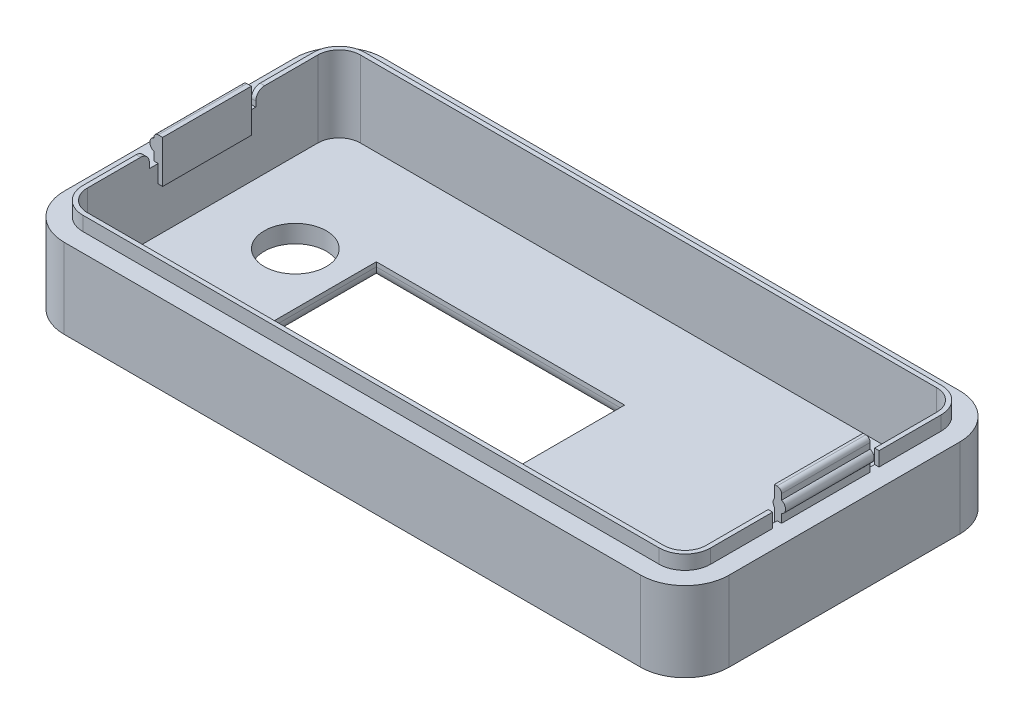
from build123d import *

# Parameters (mm, degrees)
EXTRUDE_2_DEPTH       = 9
EXTRUDE_4_DEPTH       = 1.6
SKETCH_7_W            = 0.5
SKETCH_7_H            = 10
EXTRUDE_8_DEPTH       = 2.8
SKETCH_8_R            = 0.7
EXTRUDE_9_DEPTH       = 10
FILLET_1_R            = 0.5
SKETCH_11_W           = 1
SKETCH_11_H           = 1.6
CUT_EXTRUDE_1_DEPTH   = 1.2
FILLET_2_R            = 1
SKETCH_13_W           = 0.5
SKETCH_13_H           = 10
EXTRUDE_10_DEPTH      = 2.8
CUT_EXTRUDE_START     = -7
CUT_EXTRUDE_2_DEPTH   = 7
SKETCH_13_2_W         = 0.5
SKETCH_13_2_H         = 10
EXTRUDE_11_DEPTH      = 2
EXTRUDE_12_DEPTH      = 1.6
EXTRUDE_12_DEPTH_BACK = 2
SKETCH_5_W            = 0.3
SKETCH_5_H            = 10
SKETCH_17_W           = 0.5
SKETCH_17_H           = 1
CUT_EXTRUDE_3_DEPTH   = 1.6
SKETCH_19_W           = 0.8
SKETCH_19_H           = 10
EXTRUDE_15_DEPTH      = 1.8
SKETCH_20_R           = 0.7
EXTRUDE_16_DEPTH      = 10
FILLET_4_R            = 0.5
CUT_EXTRUDE_12_REACH  = 46.232
SKETCH_27_W           = 28
SKETCH_27_H           = 15.7
FILLET_17_R           = 1.5
CUT_EXTRUDE_13_REACH  = 46.744
SKETCH_37_R           = 3.5
CUT_EXTRUDE_START_2   = -0.5
CUT_EXTRUDE_14_DEPTH  = 0.5
CUT_EXTRUDE_15_REACH  = 46.744
SKETCH_38_W           = 2.5
SKETCH_38_H           = 10
FILLET_18_R           = 1
CUT_EXTRUDE_START_3   = -0.8
CUT_EXTRUDE_16_DEPTH  = 0.8


# Read off the part's stored shape, not the designer's step: 切除-拉伸14, 切除-拉伸16
with BuildPart() as part:
    # case 2 → 凸台-拉伸2 (new body)
    with BuildSketch(Plane(origin=(0, 0, 0), x_dir=(1, 0, 0), z_dir=(0, 1, 0))):
        with BuildLine():
            Line((-34.042196447, 18), (30.957803553, 18))
            ThreePointArc((30.957803553, 18), (34.493337459, 16.535533906), (35.957803553, 13))
            Line((35.957803553, 13), (35.957803553, -13))
            ThreePointArc((35.957803553, -13), (34.493337459, -16.535533906), (30.957803553, -18))
            Line((30.957803553, -18), (-34.042196447, -18))
            ThreePointArc((-34.042196447, -18), (-37.577730353, -16.535533906), (-39.042196447, -13))
            Line((-39.042196447, -13), (-39.042196447, 13))
            ThreePointArc((-39.042196447, 13), (-37.577730353, 16.535533906), (-34.042196447, 18))
        make_face()
    extrude(amount=EXTRUDE_2_DEPTH)

    # 草图3 → 凸台-拉伸4 (add)
    with BuildSketch(Plane(origin=(0, 9, 0), x_dir=(1, 0, 0), z_dir=(0, 1, 0))):
        with BuildLine():
            Line((-36.942196447, 13), (-36.942196447, -13))
            ThreePointArc((-36.942196447, -13), (-36.092806113, -15.050609665), (-34.042196447, -15.9))
            Line((-34.042196447, -15.9), (30.957803553, -15.9))
            ThreePointArc((30.957803553, -15.9), (33.008413218, -15.050609665), (33.857803553, -13))
            Line((33.857803553, -13), (33.857803553, 13))
            ThreePointArc((33.857803553, 13), (33.008413218, 15.050609665), (30.957803553, 15.9))
            Line((30.957803553, 15.9), (-34.042196447, 15.9))
            ThreePointArc((-34.042196447, 15.9), (-36.092806113, 15.050609665), (-36.942196447, 13))
        make_face()
        with BuildLine():
            Line((-34.042196447, -15.4), (30.957803553, -15.4))
            ThreePointArc((30.957803553, -15.4), (32.654859828, -14.697056275), (33.357803553, -13))
            Line((33.357803553, -13), (33.357803553, 13))
            ThreePointArc((33.357803553, 13), (32.654859828, 14.697056275), (30.957803553, 15.4))
            Line((30.957803553, 15.4), (-34.042196447, 15.4))
            ThreePointArc((-34.042196447, 15.4), (-35.739252722, 14.697056275), (-36.442196447, 13))
            Line((-36.442196447, 13), (-36.442196447, -13))
            ThreePointArc((-36.442196447, -13), (-35.739252722, -14.697056275), (-34.042196447, -15.4))
        make_face(mode=Mode.SUBTRACT)
    extrude(amount=EXTRUDE_4_DEPTH)

    # 草图7 → 凸台-拉伸8 (add)
    with BuildSketch(Plane(origin=(0, 9, 0), x_dir=(1, 0, 0), z_dir=(0, 1, 0))):
        with Locations((-36.692196447, 0)):
            Rectangle(SKETCH_7_W, SKETCH_7_H)
    extrude(amount=EXTRUDE_8_DEPTH)

    # 草图8 → 凸台-拉伸9 (add)
    with BuildSketch(Plane.XY.offset(5)):
        with Locations((-36.692196447, 10.6)):
            Circle(SKETCH_8_R)
    extrude(amount=-EXTRUDE_9_DEPTH)

    # 圆角1
    fillet_1_edges = [part.edges().sort_by_distance(p)[0] for p in [
        (-36.942196447, 11.8, 0),
    ]]
    fillet(fillet_1_edges, radius=FILLET_1_R - 0.0001)  # a hair under: the kernel refuses the full size

    # 草图11 → 切除-拉伸1 (cut)
    with BuildSketch(Plane.ZY.offset(36.942196447)):
        with Locations((5.5, 9.8)):
            Rectangle(SKETCH_11_W, SKETCH_11_H)
        with Locations((-5.5, 9.8)):
            Rectangle(SKETCH_11_W, SKETCH_11_H)
    extrude(amount=-CUT_EXTRUDE_1_DEPTH, mode=Mode.SUBTRACT)

    # 圆角2
    fillet_2_edges = [part.edges().sort_by_distance(p)[0] for p in [
        (-36.692196447, 10.6, 6),
        (-36.692196447, 10.6, -6),
    ]]
    fillet(fillet_2_edges, radius=FILLET_2_R)

    # 草图13 → 凸台-拉伸10 (add)
    with BuildSketch(Plane(origin=(0, 9, 0), x_dir=(1, 0, 0), z_dir=(0, 1, 0))):
        with Locations((-36.192196447, 0)):
            Rectangle(SKETCH_13_W, SKETCH_13_H)
    extrude(amount=EXTRUDE_10_DEPTH)

    # 草图14 → 切除-拉伸2 (cut)
    with BuildSketch(Plane(origin=(0, 9, 0), x_dir=(1, 0, 0), z_dir=(0, 1, 0)).offset(CUT_EXTRUDE_START)):
        with BuildLine():
            Line((-34.042196447, -15.4), (30.957803553, -15.4))
            ThreePointArc((30.957803553, -15.4), (32.654859828, -14.697056275), (33.357803553, -13))
            Line((33.357803553, -13), (33.357803553, 13))
            ThreePointArc((33.357803553, 13), (32.654859828, 14.697056275), (30.957803553, 15.4))
            Line((30.957803553, 15.4), (-34.042196447, 15.4))
            ThreePointArc((-34.042196447, 15.4), (-35.739252722, 14.697056275), (-36.442196447, 13))
            Line((-36.442196447, 13), (-36.442196447, -13))
            ThreePointArc((-36.442196447, -13), (-35.739252722, -14.697056275), (-34.042196447, -15.4))
        make_face()
    extrude(amount=CUT_EXTRUDE_2_DEPTH, mode=Mode.SUBTRACT)

    # 草图13<2> → 凸台-拉伸11 (add)
    with BuildSketch(Plane(origin=(0, 9, 0), x_dir=(1, 0, 0), z_dir=(0, 1, 0))):
        with Locations((-36.192196447, 0)):
            Rectangle(SKETCH_13_2_W, SKETCH_13_2_H)
    extrude(amount=-EXTRUDE_11_DEPTH)

    # 草图5 → 凸台-拉伸12 (add, two sides: drawn at the far end of the back side and taken through both)
    with BuildSketch(Plane(origin=(0, 9, 0), x_dir=(1, 0, 0), z_dir=(0, 1, 0)).offset(-EXTRUDE_12_DEPTH_BACK)):
        with Locations((33.207803553, 0)):
            Rectangle(SKETCH_5_W, SKETCH_5_H)
    extrude(amount=EXTRUDE_12_DEPTH + EXTRUDE_12_DEPTH_BACK)

    # 草图17 → 切除-拉伸3 (cut)
    with BuildSketch(Plane(origin=(0, 10.6, 0), x_dir=(1, 0, 0), z_dir=(0, 1, 0))):
        with Locations((33.607803553, -5.5)):
            Rectangle(SKETCH_17_W, SKETCH_17_H)
        with Locations((33.607803553, 5.5)):
            Rectangle(SKETCH_17_W, SKETCH_17_H)
    extrude(amount=-CUT_EXTRUDE_3_DEPTH, mode=Mode.SUBTRACT)

    # 草图19 → 凸台-拉伸15 (add)
    with BuildSketch(Plane(origin=(0, 10.6, 0), x_dir=(1, 0, 0), z_dir=(0, 1, 0))):
        with Locations((33.457803553, 0)):
            Rectangle(SKETCH_19_W, SKETCH_19_H)
    extrude(amount=EXTRUDE_15_DEPTH)

    # 草图20 → 凸台-拉伸16 (add)
    with BuildSketch(Plane(origin=(0, 0, -5), x_dir=(-1, 0, 0), z_dir=(0, 0, -1))):
        with Locations((-33.607803553, 10.6)):
            Circle(SKETCH_20_R)
    extrude(amount=-EXTRUDE_16_DEPTH)

    # 圆角4
    fillet_4_edges = [part.edges().sort_by_distance(p)[0] for p in [
        (33.857803553, 12.4, 0),
    ]]
    fillet(fillet_4_edges, radius=FILLET_4_R)

    # 草图27 → 切除-拉伸12 (cut, up to next)
    with BuildSketch(Plane(origin=(0, 2, 0), x_dir=(1, 0, 0), z_dir=(0, 1, 0)), mode=Mode.PRIVATE) as cut_extrude_12_sk1:
        with Locations((-7.542196447, -3.15)):
            Rectangle(SKETCH_27_W, SKETCH_27_H)
    cut_extrude_12_tool1 = extrude(cut_extrude_12_sk1.sketch, amount=-CUT_EXTRUDE_12_REACH, mode=Mode.PRIVATE) & part.part
    add(cut_extrude_12_tool1.solids().sort_by_distance((-7.542196, 2, 3.15))[0], mode=Mode.SUBTRACT)

    # 圆角17
    fillet_17_edges = [part.edges().sort_by_distance(p)[0] for p in [
        (-7.542196447, 0, -4.7),
        (6.457803553, 0, 3.15),
        (-7.542196447, 0, 11),
        (-21.542196447, 0, 3.15),
    ]]
    fillet(fillet_17_edges, radius=FILLET_17_R)

    # 草图37 → 切除-拉伸13 (cut, up to next)
    with BuildSketch(Plane.XZ, mode=Mode.PRIVATE) as cut_extrude_13_sk1:
        with Locations(Location((-27.389424243, -1.408334723, 0), (0, 0, 270))):
            Circle(SKETCH_37_R)
    cut_extrude_13_tool1 = extrude(cut_extrude_13_sk1.sketch, amount=-CUT_EXTRUDE_13_REACH, mode=Mode.PRIVATE) & part.part
    add(cut_extrude_13_tool1.solids().sort_by_distance((-27.389424, 0, -1.408335))[0], mode=Mode.SUBTRACT)

    # 切除-拉伸14 outline → 切除-拉伸14 (cut)
    with BuildSketch(Plane.XZ.offset(CUT_EXTRUDE_START_2)):
        with BuildLine():
            Line((-32.307197099, 14.675448373), (-32.594748949, 14.84319914))
            add(Edge.make_bspline(
                [(-32.594748949, 14.84319914), (-32.688625023, 14.895110099), (-32.79244694, 14.923070591), (-33.000139527, 14.923070591), (-33.103985821, 14.895110099), (-33.197837519, 14.84319914)],
                knots=[3, 3, 3, 3, 4, 4, 5, 5, 5, 5], degree=3))
            Line((-33.197837519, 14.84319914), (-33.485413746, 14.675448373))
            Line((-33.485413746, 14.675448373), (-34.977143816, 13.814755176))
            Line((-34.977143816, 13.814755176), (-35.264720043, 13.649003328))
            add(Edge.make_bspline(
                [(-35.264720043, 13.649003328), (-35.450424518, 13.541171384), (-35.566264327, 13.341474474), (-35.566264327, 13.127797317)],
                knots=[8, 8, 8, 8, 9, 9, 9, 9], degree=3))
            Line((-35.566264327, 13.127797317), (-35.566264327, 10.739417881))
            add(Edge.make_bspline(
                [(-35.566264327, 10.739417881), (-35.566264327, 10.523753994), (-35.450424518, 10.326043814), (-35.264720043, 10.21821187)],
                knots=[10, 10, 10, 10, 11, 11, 11, 11], degree=3))
            Line((-35.264720043, 10.21821187), (-34.977143816, 10.052460022))
            Line((-34.977143816, 10.052460022), (-33.485413746, 9.191766826))
            Line((-33.485413746, 9.191766826), (-33.197837519, 9.024028247))
            add(Edge.make_bspline(
                [(-33.197837519, 9.024028247), (-33.103985821, 8.97010618), (-33.000139527, 8.944144607), (-32.79244694, 8.944144607), (-32.688625023, 8.97010618), (-32.594748949, 9.024028247)],
                knots=[14, 14, 14, 14, 15, 15, 16, 16, 16, 16], degree=3))
            Line((-32.594748949, 9.024028247), (-32.307197099, 9.191766826))
            Line((-32.307197099, 9.191766826), (-30.815467029, 10.052460022))
            Line((-30.815467029, 10.052460022), (-30.527915179, 10.21821187))
            add(Edge.make_bspline(
                [(-30.527915179, 10.21821187), (-30.340187407, 10.326043814), (-30.226370894, 10.523753994), (-30.226370894, 10.739417881)],
                knots=[19, 19, 19, 19, 20, 20, 20, 20], degree=3))
            Line((-30.226370894, 10.739417881), (-30.226370894, 13.127797317))
            add(Edge.make_bspline(
                [(-30.226370894, 13.127797317), (-30.226370894, 13.341474474), (-30.340187407, 13.541171384), (-30.527915179, 13.649003328)],
                knots=[21, 21, 21, 21, 22, 22, 22, 22], degree=3))
            Line((-30.527915179, 13.649003328), (-30.815467029, 13.814755176))
            Line((-30.815467029, 13.814755176), (-32.307197099, 14.675448373))
        make_face()
        with BuildLine():
            add(Edge.make_bspline(
                [(-32.171416851, 10.645566184), (-31.943735071, 10.773375132), (-31.835915316, 10.941113711), (-31.835915316, 11.326527285), (-31.959726425, 11.324528366), (-32.18338599, 11.196731607)],
                knots=[0, 0, 0, 0, 1, 1, 2.031545133, 2.031545133, 2.031545133, 2.031545133], degree=3))
            Line((-32.18338599, 11.196731607), (-32.355122407, 11.100868801))
            add(Edge.make_bspline(
                [(-32.3751116, 11.066923739), (-32.3751116, 11.080903986), (-32.367115923, 11.094884232), (-32.355122407, 11.100868801)],
                knots=[4, 4, 4, 4, 5, 5, 5, 5], degree=3))
            Line((-32.3751116, 11.066923739), (-32.3751116, 9.541236419))
            add(Edge.make_bspline(
                [(-32.395052038, 9.507291357), (-32.381083981, 9.515274845), (-32.3751116, 9.527256173), (-32.3751116, 9.541236419)],
                knots=[3, 3, 3, 3, 4, 4, 4, 4], degree=3))
            Line((-32.395052038, 9.507291357), (-32.782476721, 9.287629631))
            add(Edge.make_bspline(
                [(-32.840396625, 9.321574693), (-32.840396625, 9.291615281), (-32.808438294, 9.273649385), (-32.782476721, 9.287629631)],
                knots=[5, 5, 5, 5, 6, 6, 6, 6], degree=3))
            Line((-32.840396625, 9.321574693), (-32.840396625, 11.170770033))
            add(Edge.make_bspline(
                [(-32.82043181, 11.204715095), (-32.834399868, 11.198730526), (-32.840396625, 11.18475028), (-32.840396625, 11.170770033)],
                knots=[7, 7, 7, 7, 8, 8, 8, 8], degree=3))
            Line((-32.82043181, 11.204715095), (-32.161422255, 11.578147342))
            add(Edge.make_bspline(
                [(-32.161422255, 11.578147342), (-31.734067941, 11.819784992), (-31.380624887, 11.8677103), (-31.380624887, 10.927133464), (-31.73806578, 10.521755074), (-32.14742982, 10.290099833)],
                knots=[9, 9, 9, 9, 10, 10, 10.962489192, 10.962489192, 10.962489192, 10.962489192], degree=3))
            Line((-32.14742982, 10.290099833), (-32.355122407, 10.174284401))
            Line((-32.355122407, 10.174284401), (-32.355122407, 10.553701217))
            Line((-32.355122407, 10.553701217), (-32.171416851, 10.645566184))
        make_face(mode=Mode.SUBTRACT)
        with BuildLine():
            add(Edge.make_bspline(
                [(-30.779535236, 10.413910942), (-30.767541721, 10.4199077), (-30.759546043, 10.433887946), (-30.759546043, 10.447868193)],
                knots=[0, 0, 0, 0, 1, 1, 1, 1], degree=3))
            Line((-30.779535236, 10.413910942), (-31.162937703, 10.196248135))
            add(Edge.make_bspline(
                [(-31.220857607, 10.230193197), (-31.220857607, 10.200245974), (-31.188899276, 10.182267889), (-31.162937703, 10.196248135)],
                knots=[2, 2, 2, 2, 3, 3, 3, 3], degree=3))
            Line((-31.220857607, 10.230193197), (-31.220857607, 11.110863398))
            add(Edge.make_bspline(
                [(-31.200868415, 11.14480846), (-31.21286193, 11.136824971), (-31.220857607, 11.124831456), (-31.220857607, 11.110863398)],
                knots=[4, 4, 4, 4, 5, 5, 5, 5], degree=3))
            Line((-31.200868415, 11.14480846), (-30.817465948, 11.360484536))
            add(Edge.make_bspline(
                [(-30.759546043, 11.326527285), (-30.759546043, 11.356486697), (-30.791504375, 11.374452594), (-30.817465948, 11.360484536)],
                knots=[6, 6, 6, 6, 7, 7, 7, 7], degree=3))
            Line((-30.759546043, 11.326527285), (-30.759546043, 10.447868193))
        make_face(mode=Mode.SUBTRACT)
        with BuildLine():
            add(Edge.make_bspline(
                [(-30.989202366, 11.945595021), (-31.144947429, 11.857727892), (-31.254790481, 11.697972802), (-31.254790481, 11.556183608), (-31.254790481, 11.418392252), (-31.144947429, 11.380449351), (-30.989202366, 11.470315399)],
                knots=[0, 0, 0, 0, 1, 1, 1, 2, 2, 2, 2], degree=3))
            add(Edge.make_bspline(
                [(-30.989202366, 11.470315399), (-30.835431845, 11.556183608), (-30.72561317, 11.717937617), (-30.72561317, 11.855728973), (-30.72561317, 11.995519248), (-30.835431845, 12.033462149), (-30.989202366, 11.945595021)],
                knots=[2, 2, 2, 2, 3, 3, 3, 4, 4, 4, 4], degree=3))
        make_face(mode=Mode.SUBTRACT)
        with BuildLine():
            add(Edge.make_bspline(
                [(-33.090017763, 12.097366623), (-32.970204493, 12.027465391), (-32.82043181, 12.027465391), (-32.700594162, 12.097366623)],
                knots=[7, 7, 7, 7, 8, 8, 8, 8], degree=3))
            add(Edge.make_bspline(
                [(-34.899259095, 13.141777563), (-34.895261257, 13.139778644), (-33.090017763, 12.097366623)],
                knots=[0, 0, 0, 1, 1, 1], degree=2))
            add(Edge.make_bspline(
                [(-34.881293199, 13.411363517), (-34.983140573, 13.353455801), (-34.993110793, 13.209667687), (-34.899259095, 13.141777563)],
                knots=[1, 1, 1, 1, 2, 2, 2, 2], degree=3))
            Line((-34.881293199, 13.411363517), (-33.036095697, 14.477750381))
            add(Edge.make_bspline(
                [(-32.754516228, 14.477750381), (-32.842371168, 14.527674609), (-32.9502153, 14.527674609), (-33.036095697, 14.477750381)],
                knots=[3, 3, 3, 3, 4, 4, 4, 4], degree=3))
            Line((-32.754516228, 14.477750381), (-30.919313323, 13.409364598))
            add(Edge.make_bspline(
                [(-30.917314403, 13.163741298), (-30.823462706, 13.219662284), (-30.825461625, 13.35545472), (-30.919313323, 13.409364598)],
                knots=[5, 5, 5, 5, 6, 6, 6, 6], degree=3))
            Line((-30.917314403, 13.163741298), (-32.700594162, 12.097366623))
        make_face(mode=Mode.SUBTRACT)
    extrude(amount=CUT_EXTRUDE_14_DEPTH, mode=Mode.SUBTRACT)

    # 草图38 → 切除-拉伸15 (cut, up to next)
    with BuildSketch(Plane.XZ, mode=Mode.PRIVATE) as cut_extrude_15_sk1:
        with Locations((27.207803553, 3.6)):
            Rectangle(SKETCH_38_W, SKETCH_38_H)
    cut_extrude_15_tool1 = extrude(cut_extrude_15_sk1.sketch, amount=-CUT_EXTRUDE_15_REACH, mode=Mode.PRIVATE) & part.part
    add(cut_extrude_15_tool1.solids().sort_by_distance((27.207804, 0, 3.6))[0], mode=Mode.SUBTRACT)

    # 圆角18
    fillet_18_edges = [part.edges().sort_by_distance(p)[0] for p in [
        (25.957803553, 1, -1.4),
        (25.957803553, 1, 8.6),
        (28.457803553, 1, 8.6),
        (28.457803553, 1, -1.4),
    ]]
    fillet(fillet_18_edges, radius=FILLET_18_R)

    # 切除-拉伸16 outline → 切除-拉伸16 (cut)
    # profile 1 of 6: a face of its own
    with BuildSketch(Plane.XZ.offset(CUT_EXTRUDE_START_3)):
        with BuildLine():
            add(Edge.make_bspline(
                [(28.821470704, -13.285178936), (28.790080057, -13.233073492), (28.730286396, -13.133821785), (28.637541017, -12.996439911), (28.54897428, -12.874812887), (28.456431009, -12.773976637), (28.362258186, -12.691383612), (28.262530085, -12.631106576), (28.155887798, -12.59094101), (28.08114737, -12.586356453), (28.043181231, -12.58402762)],
                knots=[0, 0, 0, 0, 0.166616267, 0.317374686, 0.454054005, 0.578317085, 0.691671191, 0.795890415, 0.896317786, 1, 1, 1, 1], degree=3))
            Line((28.821470704, -13.285178936), (29.693016757, -14.720869725))
            Line((29.693016757, -14.720869725), (31.134464125, -14.720869725))
            Line((31.134464125, -14.720869725), (30.086766757, -13.069882883))
            add(Edge.make_bspline(
                [(29.235944389, -12.224817094), (29.277421788, -12.24010595), (29.362805689, -12.271579048), (29.478990544, -12.351528385), (29.593206349, -12.445754453), (29.701981651, -12.556533112), (29.80815394, -12.676886292), (29.906249165, -12.806567941), (30.000164974, -12.937345198), (30.058292552, -13.026305197), (30.086766757, -13.069882883)],
                knots=[0, 0, 0, 0, 0.108308314, 0.222959649, 0.344272461, 0.472394006, 0.604137966, 0.73872092, 0.872010593, 1, 1, 1, 1], degree=3))
            Line((29.235944389, -12.224817094), (29.235944389, -12.208698673))
            add(Edge.make_bspline(
                [(30.503543073, -10.647514462), (30.502526194, -10.69555023), (30.5005263, -10.790022074), (30.482058045, -10.928873877), (30.45585676, -11.062703539), (30.414294482, -11.189638547), (30.364862023, -11.31094095), (30.30651188, -11.426719689), (30.236209926, -11.535284407), (30.158437768, -11.639048188), (30.070924915, -11.735766628), (29.974261568, -11.824573002), (29.870654989, -11.908250637), (29.757540026, -11.983341226), (29.638005842, -12.053552345), (29.509570777, -12.112095166), (29.375946836, -12.166314896), (29.283015416, -12.194448579), (29.235944389, -12.208698673)],
                knots=[0, 0, 0, 0, 0.066352771, 0.130495854, 0.193325077, 0.254551022, 0.314731918, 0.374271311, 0.433419609, 0.493248882, 0.55333153, 0.613381394, 0.674513074, 0.737180896, 0.800864009, 0.865878345, 0.932065558, 1, 1, 1, 1], degree=3))
            add(Edge.make_bspline(
                [(28.457654915, -9.120869725), (28.540206375, -9.121780989), (28.700157051, -9.123546641), (28.932295779, -9.14263352), (29.148508398, -9.171677088), (29.34896779, -9.213216366), (29.533773295, -9.265452151), (29.702979196, -9.330794123), (29.855207455, -9.409653787), (29.993433586, -9.497925408), (30.112989546, -9.60138503), (30.218561486, -9.714858811), (30.306135512, -9.841799549), (30.37921406, -9.979554326), (30.436360381, -10.12946537), (30.474200302, -10.291794327), (30.499439334, -10.465586701), (30.502147184, -10.585631645), (30.503543073, -10.647514462)],
                knots=[0, 0, 0, 0, 0.085072713, 0.164835824, 0.239912713, 0.309814075, 0.375670734, 0.437670893, 0.496408874, 0.552146374, 0.606294627, 0.65892908, 0.711493621, 0.764757564, 0.819344749, 0.876335745, 0.936251438, 1, 1, 1, 1], degree=3))
            Line((28.457654915, -9.120869725), (26.450911494, -9.120869725))
            Line((26.450911494, -9.120869725), (26.450911494, -14.720869725))
            Line((26.450911494, -14.720869725), (27.703543073, -14.720869725))
            Line((27.703543073, -14.720869725), (27.703543073, -12.58402762))
            Line((27.703543073, -12.58402762), (28.043181231, -12.58402762))
        make_face()
        with BuildLine():
            add(Edge.make_bspline(
                [(29.177227283, -10.807547357), (29.176626399, -10.777963438), (29.175467442, -10.720903399), (29.164792389, -10.63803053), (29.147716078, -10.560886679), (29.123950403, -10.488607795), (29.090991265, -10.423157632), (29.053278364, -10.361943704), (29.006520259, -10.308299462), (28.95436564, -10.25870132), (28.894092254, -10.216785421), (28.82767925, -10.179105381), (28.75401285, -10.148619779), (28.673422579, -10.12331766), (28.586245744, -10.102140586), (28.4913112, -10.089518273), (28.389947991, -10.079274197), (28.319911105, -10.078937852), (28.283806231, -10.078764462)],
                knots=[0, 0, 0, 0, 0.06726802, 0.129743318, 0.189678709, 0.246821831, 0.302259206, 0.35602177, 0.409897607, 0.463631815, 0.519343431, 0.576406483, 0.637043414, 0.700264404, 0.76844385, 0.840788046, 0.917924284, 1, 1, 1, 1], degree=3))
            add(Edge.make_bspline(
                [(28.922786494, -11.393567094), (28.94317962, -11.37363319), (28.983304094, -11.33441226), (29.035190515, -11.269370034), (29.079350951, -11.201178381), (29.115192544, -11.129346349), (29.143368181, -11.05375048), (29.161999807, -10.97438184), (29.176002413, -10.892081402), (29.176814884, -10.83600895), (29.177227283, -10.807547357)],
                knots=[0, 0, 0, 0, 0.129841783, 0.25547006, 0.37819239, 0.499410405, 0.620577955, 0.744847917, 0.870488364, 1, 1, 1, 1], degree=3))
            add(Edge.make_bspline(
                [(28.259628599, -11.626132883), (28.293448228, -11.625659532), (28.359377942, -11.624736756), (28.455020226, -11.612080726), (28.546410181, -11.595939311), (28.631577985, -11.568910296), (28.712848458, -11.536598502), (28.788358863, -11.496280542), (28.859378648, -11.449279145), (28.901687946, -11.412104916), (28.922786494, -11.393567094)],
                knots=[0, 0, 0, 0, 0.140812703, 0.274507487, 0.401531903, 0.526986243, 0.646071424, 0.765542549, 0.883082156, 1, 1, 1, 1], degree=3))
            Line((28.259628599, -11.626132883), (27.703543073, -11.626132883))
            Line((27.703543073, -11.626132883), (27.703543073, -10.078764462))
            Line((27.703543073, -10.078764462), (28.283806231, -10.078764462))
        make_face(mode=Mode.SUBTRACT)
    # profile 2 of 6: a face of its own
    with BuildSketch(Plane.XZ.offset(CUT_EXTRUDE_START_3)):
        with BuildLine():
            add(Edge.make_bspline(
                [(22.544036494, -13.018073673), (22.558892923, -13.068950535), (22.587639704, -13.167395863), (22.618517296, -13.312324022), (22.644667325, -13.447172972), (22.652910148, -13.534539348), (22.656865441, -13.57646183)],
                knots=[0, 0, 0, 0, 0.278523147, 0.538934631, 0.778759223, 1, 1, 1, 1], degree=3))
            Line((22.544036494, -13.018073673), (21.383510178, -9.120869725))
            Line((21.383510178, -9.120869725), (20.033016757, -9.120869725))
            Line((20.033016757, -9.120869725), (21.926931231, -14.720869725))
            Line((21.926931231, -14.720869725), (23.347654915, -14.720869725))
            Line((23.347654915, -14.720869725), (25.264595704, -9.120869725))
            Line((25.264595704, -9.120869725), (23.95324702, -9.120869725))
            Line((23.95324702, -9.120869725), (22.799628599, -13.001955251))
            add(Edge.make_bspline(
                [(22.679891757, -13.57646183), (22.685683827, -13.531894), (22.697607755, -13.440143797), (22.722877654, -13.299344414), (22.757870407, -13.152486175), (22.785493167, -13.052910993), (22.799628599, -13.001955251)],
                knots=[0, 0, 0, 0, 0.229460129, 0.47238138, 0.730001014, 1, 1, 1, 1], degree=3))
            Line((22.679891757, -13.57646183), (22.656865441, -13.57646183))
        make_face()
    # profile 3 of 6: a face of its own
    with BuildSketch(Plane.XZ.offset(CUT_EXTRUDE_START_3)):
        with BuildLine():
            add(Edge.make_bspline(
                [(12.299858862, -12.704915778), (12.237128741, -12.748036103), (12.113218506, -12.833211287), (11.93474981, -12.962170899), (11.767046795, -13.08634512), (11.621903834, -13.212461071), (11.498315278, -13.334072325), (11.416746898, -13.437759794), (11.36807729, -13.519046233), (11.342499271, -13.57646515), (11.326014321, -13.633113762), (11.324358008, -13.670765474), (11.323543073, -13.689290778)],
                knots=[0, 0, 0, 0, 0.160375386, 0.316788032, 0.463954722, 0.599810878, 0.721597888, 0.828827593, 0.87667161, 0.920841975, 0.96105286, 1, 1, 1, 1], degree=3))
            add(Edge.make_bspline(
                [(13.75512202, -10.631396041), (13.753377786, -10.69361387), (13.749964437, -10.815369937), (13.729087992, -10.993110447), (13.689015252, -11.159730412), (13.63615949, -11.316251701), (13.569178407, -11.462712538), (13.494480517, -11.603383445), (13.408138038, -11.736299769), (13.31191663, -11.8625958), (13.206430869, -11.981769305), (13.095070649, -12.097952298), (12.973627864, -12.206708481), (12.80250238, -12.346159443), (12.578023296, -12.513159964), (12.393124811, -12.640621837), (12.299858862, -12.704915778)],
                knots=[0, 0, 0, 0, 0.070274231, 0.137521897, 0.201645623, 0.263456112, 0.32378572, 0.383312987, 0.443178485, 0.502554106, 0.562444697, 0.622822543, 0.684189306, 0.746395083, 0.872077357, 1, 1, 1, 1], degree=3))
            add(Edge.make_bspline(
                [(11.93949702, -9.047185515), (12.008623162, -9.048487182), (12.143745304, -9.051031576), (12.341004768, -9.071578475), (12.526815913, -9.107541434), (12.701381494, -9.155662221), (12.864240048, -9.216426426), (13.014307065, -9.290060019), (13.15126268, -9.375759249), (13.275242093, -9.472926151), (13.38644466, -9.58146831), (13.483636343, -9.70153889), (13.565830394, -9.83338994), (13.634931681, -9.974825285), (13.689516285, -10.126442755), (13.726758729, -10.287243112), (13.750564797, -10.456455402), (13.753580292, -10.572212873), (13.75512202, -10.631396041)],
                knots=[0, 0, 0, 0, 0.076136194, 0.14882482, 0.218136801, 0.284394431, 0.348073216, 0.409328816, 0.468210251, 0.52571743, 0.582516363, 0.639031411, 0.695448344, 0.753302534, 0.812138424, 0.872533151, 0.934830194, 1, 1, 1, 1], degree=3))
            add(Edge.make_bspline(
                [(10.291964125, -9.516922357), (10.353193685, -9.479096292), (10.475046868, -9.403818494), (10.667164383, -9.308736241), (10.864731964, -9.227311292), (11.068712387, -9.162457892), (11.278102074, -9.109726536), (11.493307489, -9.07353529), (11.714494236, -9.050732387), (11.863837268, -9.048378191), (11.93949702, -9.047185515)],
                knots=[0, 0, 0, 0, 0.124218059, 0.247206838, 0.369651686, 0.492877681, 0.616473746, 0.742195786, 0.869391945, 1, 1, 1, 1], degree=3))
            Line((10.291964125, -9.516922357), (10.291964125, -10.594553936))
            add(Edge.make_bspline(
                [(11.67699702, -10.005080251), (11.617023838, -10.006858885), (11.496830959, -10.010423463), (11.317821056, -10.039212493), (11.140778078, -10.08529697), (10.965933807, -10.150646029), (10.792862688, -10.233783867), (10.622150895, -10.335940393), (10.453213239, -10.455750508), (10.346508416, -10.547602146), (10.291964125, -10.594553936)],
                knots=[0, 0, 0, 0, 0.11678746, 0.234054964, 0.352290892, 0.472700507, 0.597099173, 0.725834873, 0.859855048, 1, 1, 1, 1], degree=3))
            add(Edge.make_bspline(
                [(12.502490441, -10.751132883), (12.500341603, -10.692967957), (12.496275382, -10.582903149), (12.458517496, -10.428392164), (12.393065544, -10.297393959), (12.317427336, -10.20679998), (12.244490888, -10.148633124), (12.183871731, -10.109358163), (12.115716248, -10.076771828), (12.04106199, -10.050826942), (11.959445295, -10.029914031), (11.871278192, -10.015042944), (11.77613854, -10.007537264), (11.710779937, -10.005917489), (11.67699702, -10.005080251)],
                knots=[0, 0, 0, 0, 0.136703988, 0.258683353, 0.370941413, 0.47857603, 0.533149274, 0.590005303, 0.648158595, 0.710415069, 0.775676489, 0.846186152, 0.920495846, 1, 1, 1, 1], degree=3))
            add(Edge.make_bspline(
                [(11.495089125, -12.06708683), (11.573432708, -12.010501786), (11.721937961, -11.903241229), (11.927324953, -11.740834986), (12.100996294, -11.580751068), (12.24613567, -11.422606889), (12.361183644, -11.263807803), (12.443749465, -11.099929408), (12.493237007, -10.928239765), (12.499385971, -10.81055115), (12.502490441, -10.751132883)],
                knots=[0, 0, 0, 0, 0.168174123, 0.318784766, 0.455361744, 0.578769898, 0.691808674, 0.795448475, 0.896726655, 1, 1, 1, 1], degree=3))
            add(Edge.make_bspline(
                [(9.997227283, -14.286823673), (9.99885607, -14.21763617), (10.002036878, -14.082522031), (10.030970205, -13.885623276), (10.074670928, -13.698696188), (10.140290325, -13.523601573), (10.21997059, -13.359273963), (10.305488958, -13.201740548), (10.402564052, -13.05419007), (10.509385023, -12.916107126), (10.621797509, -12.784856745), (10.740634049, -12.661941369), (10.863760701, -12.545909299), (11.034167505, -12.406739091), (11.243951399, -12.246314347), (11.413414626, -12.125374838), (11.495089125, -12.06708683)],
                knots=[0, 0, 0, 0, 0.074122296, 0.144751143, 0.212899553, 0.279538751, 0.344679238, 0.408571093, 0.471554573, 0.533759381, 0.595604021, 0.656702572, 0.716951784, 0.776840371, 0.892445983, 1, 1, 1, 1], degree=3))
            Line((9.997227283, -14.286823673), (9.997227283, -14.720869725))
            Line((9.997227283, -14.720869725), (13.75512202, -14.720869725))
            Line((13.75512202, -14.720869725), (13.75512202, -13.689290778))
            Line((13.75512202, -13.689290778), (11.323543073, -13.689290778))
        make_face()
    # profile 4 of 6: a face of its own
    with BuildSketch(Plane.XZ.offset(CUT_EXTRUDE_START_3)):
        with BuildLine():
            add(Edge.make_bspline(
                [(0.118016757, -9.120869725), (0.192488301, -9.122131924), (0.336979651, -9.12458087), (0.547356657, -9.138966213), (0.744155188, -9.165571072), (0.928010857, -9.201455489), (1.09773167, -9.250596701), (1.255500019, -9.307352142), (1.399742935, -9.376456867), (1.530321849, -9.456170205), (1.647360257, -9.544346792), (1.748255659, -9.642704447), (1.83330084, -9.750155967), (1.904062292, -9.86538877), (1.958912026, -9.990059105), (1.996277499, -10.123452904), (2.020086632, -10.265198328), (2.023067004, -10.362657201), (2.024595704, -10.412646041)],
                knots=[0, 0, 0, 0, 0.086111784, 0.167076003, 0.243636736, 0.315604137, 0.383442271, 0.447738418, 0.509263166, 0.568013132, 0.624368313, 0.67833919, 0.730452185, 0.782428986, 0.834286324, 0.887374422, 0.942231817, 1, 1, 1, 1], degree=3))
            Line((0.118016757, -9.120869725), (-1.880667454, -9.120869725))
            Line((-1.880667454, -9.120869725), (-1.880667454, -14.720869725))
            Line((-1.880667454, -14.720869725), (0.230845704, -14.720869725))
            add(Edge.make_bspline(
                [(2.245648336, -13.027284199), (2.244255786, -13.090691975), (2.24153481, -13.214587718), (2.215754651, -13.395245858), (2.172849378, -13.565642452), (2.114450117, -13.726688097), (2.037933055, -13.877475529), (1.943940477, -14.017426805), (1.833390183, -14.147449206), (1.707004356, -14.267065547), (1.565157206, -14.373507806), (1.411374726, -14.467781907), (1.244236361, -14.545819317), (1.065516124, -14.610465552), (0.874199294, -14.65969432), (0.670929313, -14.694925323), (0.455092733, -14.717495196), (0.306890741, -14.719725379), (0.230845704, -14.720869725)],
                knots=[0, 0, 0, 0, 0.063980294, 0.125014415, 0.183740077, 0.241100441, 0.297582768, 0.353993304, 0.41088997, 0.46953635, 0.52927556, 0.589604776, 0.651299274, 0.71514689, 0.781204705, 0.850438617, 0.923257435, 1, 1, 1, 1], degree=3))
            add(Edge.make_bspline(
                [(0.956174652, -11.674488146), (1.003926114, -11.681302599), (1.097873637, -11.694709537), (1.233740126, -11.729256923), (1.363010621, -11.770005882), (1.484793842, -11.820519728), (1.598276939, -11.882542299), (1.705068613, -11.952428264), (1.805311194, -12.030931123), (1.895542546, -12.119670168), (1.977085293, -12.214917525), (2.049173661, -12.315620237), (2.110271646, -12.421575177), (2.160427126, -12.532939093), (2.197951709, -12.64974249), (2.225969669, -12.770981232), (2.242179029, -12.897515303), (2.244477487, -12.983488762), (2.245648336, -13.027284199)],
                knots=[0, 0, 0, 0, 0.070303358, 0.138316736, 0.204165203, 0.2678883, 0.330249721, 0.392503034, 0.453869322, 0.515617324, 0.57675344, 0.636550183, 0.69597904, 0.754857078, 0.814330728, 0.874617959, 0.936129577, 1, 1, 1, 1], degree=3))
            Line((0.956174652, -11.674488146), (0.956174652, -11.658369725))
            add(Edge.make_bspline(
                [(2.024595704, -10.412646041), (2.023707665, -10.449142514), (2.021953113, -10.521250776), (2.008030241, -10.628165591), (1.983440342, -10.731166352), (1.951593883, -10.83144159), (1.908417187, -10.927186083), (1.85605215, -11.019794991), (1.795415768, -11.109625684), (1.701126097, -11.22311604), (1.566508078, -11.351358746), (1.383476424, -11.482022061), (1.179071619, -11.58726538), (1.031437232, -11.63436089), (0.956174652, -11.658369725)],
                knots=[0, 0, 0, 0, 0.06200521, 0.122507397, 0.182773666, 0.241752556, 0.301011975, 0.36086759, 0.422363197, 0.48490106, 0.611275607, 0.73703793, 0.865944483, 1, 1, 1, 1], degree=3))
        make_face()
        with BuildLine():
            add(Edge.make_bspline(
                [(0.919332546, -13.006560515), (0.918813757, -12.979264677), (0.917800424, -12.92594869), (0.90568262, -12.848473021), (0.88751239, -12.775480517), (0.861976716, -12.707167045), (0.829867213, -12.642930818), (0.788570612, -12.584199281), (0.741909559, -12.528195534), (0.666460015, -12.462296495), (0.557496282, -12.389393659), (0.402525904, -12.330791895), (0.225618459, -12.294526404), (0.100177001, -12.291099468), (0.033970704, -12.289290778)],
                knots=[0, 0, 0, 0, 0.063501449, 0.124035115, 0.182118418, 0.238386167, 0.293535902, 0.348808571, 0.405218052, 0.462804318, 0.581520604, 0.708296958, 0.8460431, 1, 1, 1, 1], degree=3))
            add(Edge.make_bspline(
                [(0.025911494, -13.762974988), (0.092112372, -13.76078184), (0.218432603, -13.756597016), (0.396668936, -13.718803372), (0.552461357, -13.655040444), (0.66362664, -13.580135584), (0.738101532, -13.508639097), (0.786756823, -13.450752542), (0.828600622, -13.388476702), (0.862207571, -13.321145507), (0.887633901, -13.24872343), (0.905532208, -13.171876718), (0.91781829, -13.090613077), (0.918820067, -13.035006956), (0.919332546, -13.006560515)],
                knots=[0, 0, 0, 0, 0.149925312, 0.286077774, 0.410470854, 0.529419024, 0.587251437, 0.644054111, 0.700509365, 0.756917688, 0.814145061, 0.874065956, 0.935575879, 1, 1, 1, 1], degree=3))
            Line((0.025911494, -13.762974988), (-0.628035875, -13.762974988))
            Line((-0.628035875, -13.762974988), (-0.628035875, -12.289290778))
            Line((-0.628035875, -12.289290778), (0.033970704, -12.289290778))
        make_face(mode=Mode.SUBTRACT)
        with BuildLine():
            add(Edge.make_bspline(
                [(0.698279915, -10.661330251), (0.696020847, -10.615275976), (0.691718734, -10.527571321), (0.648123844, -10.405518345), (0.578067494, -10.301691493), (0.478956628, -10.216603177), (0.351084419, -10.154228526), (0.197922993, -10.110590122), (0.018447949, -10.082950527), (-0.110214055, -10.080223096), (-0.179022717, -10.078764462)],
                knots=[0, 0, 0, 0, 0.115482616, 0.219922315, 0.321419458, 0.427510883, 0.544533228, 0.676506008, 0.826994855, 1, 1, 1, 1], degree=3))
            add(Edge.make_bspline(
                [(-0.100733243, -11.331396041), (-0.041840241, -11.3293335), (0.070465046, -11.325400362), (0.228945828, -11.291950231), (0.368265163, -11.236807193), (0.486119992, -11.157861799), (0.580736063, -11.05875076), (0.651328145, -10.942234723), (0.690598403, -10.806520459), (0.695647658, -10.7110832), (0.698279915, -10.661330251)],
                knots=[0, 0, 0, 0, 0.149921494, 0.285890953, 0.410451161, 0.52950521, 0.644311574, 0.756999804, 0.873320163, 1, 1, 1, 1], degree=3))
            Line((-0.100733243, -11.331396041), (-0.628035875, -11.331396041))
            Line((-0.628035875, -11.331396041), (-0.628035875, -10.078764462))
            Line((-0.628035875, -10.078764462), (-0.179022717, -10.078764462))
        make_face(mode=Mode.SUBTRACT)
    # profile 5 of 6: a face of its own
    with BuildSketch(Plane.XZ.offset(CUT_EXTRUDE_START_3)):
        Polygon((16.488806231, -14.720869725), (17.74143781, -14.720869725), (17.74143781, -10.152448673), (19.362490441, -10.152448673), (19.362490441, -9.120869725), (14.94143781, -9.120869725), (14.94143781, -10.152448673), (16.488806231, -10.152448673), align=None)
    # profile 6 of 6: a face of its own
    with BuildSketch(Plane.XZ.offset(CUT_EXTRUDE_START_3)):
        Polygon((7.263543073, -14.720869725), (8.516174652, -14.720869725), (8.516174652, -9.120869725), (7.263543073, -9.120869725), (7.263543073, -11.331396041), (4.979332546, -11.331396041), (4.979332546, -9.120869725), (3.726700967, -9.120869725), (3.726700967, -14.720869725), (4.979332546, -14.720869725), (4.979332546, -12.436659199), (7.263543073, -12.436659199), align=None)
    extrude(amount=CUT_EXTRUDE_16_DEPTH, mode=Mode.SUBTRACT)


solid = part.part
